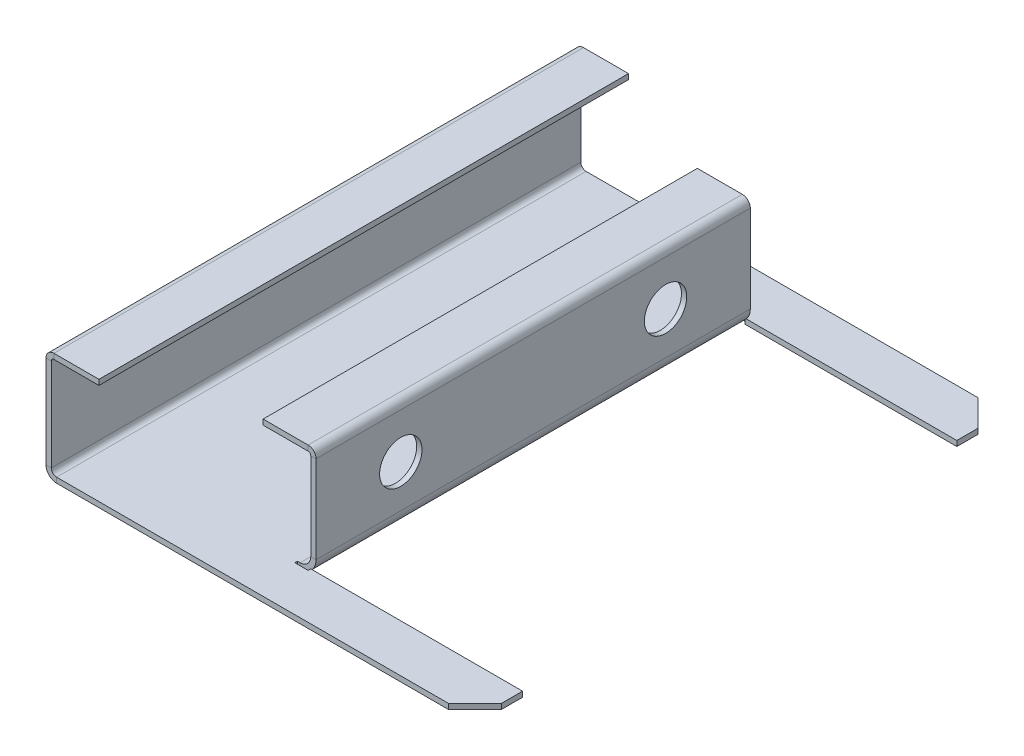
from build123d import *

# Parameters (mm, degrees)
BASE_FLANGE1_DEPTH           = 1
BREAK_CORNER1_START          = 60.104076401
BREAK_CORNER1_OUTLINE_W      = 72.104076401
BREAK_CORNER1_OUTLINE_H      = 3
BREAK_CORNER1_DEPTH          = 3.535533906
BREAK_CORNER1_START_2        = -12
BREAK_CORNER1_2_OUTLINE_W    = 4.895923599
BREAK_CORNER1_2_OUTLINE_H    = 3
BREAK_CORNER1_2_DEPTH        = 11.292893219
EDGE_FLANGE1_STRIP_W         = 6
EDGE_FLANGE1_STRIP_H         = 1
EDGE_FLANGE1_STRIP_CUT_DEPTH = 100
EDGE_FLANGE1_DEPTH           = 100
EDGE_FLANGE2_STRIP_W         = 5
EDGE_FLANGE2_STRIP_H         = 1
EDGE_FLANGE2_STRIP_CUT_DEPTH = 100
EDGE_FLANGE2_DEPTH           = 100
EDGE_FLANGE3_START           = -2.5
EDGE_FLANGE3_OUTLINE_W       = 0.5
EDGE_FLANGE3_OUTLINE_H       = 1
EDGE_FLANGE3_DEPTH           = 2.5
EDGE_FLANGE3_START_2         = -1.23595
EDGE_FLANGE3_2_OUTLINE_W     = 19
EDGE_FLANGE3_2_OUTLINE_H     = 82
EDGE_FLANGE3_2_DEPTH         = 2.23595
EDGE_FLANGE3_3_OUTLINE_W     = 1
EDGE_FLANGE3_3_OUTLINE_H     = 82
EDGE_FLANGE3_3_DEPTH         = 0.70822
EDGE_FLANGE3_START_3         = -41
EDGE_FLANGE3_4_DEPTH         = 82
EDGE_FLANGE3_5_DEPTH         = 82
EDGE_FLANGE4_STRIP_W         = 5
EDGE_FLANGE4_STRIP_H         = 1
EDGE_FLANGE4_STRIP_CUT_DEPTH = 82
EDGE_FLANGE4_DEPTH           = 82
SKETCH18_R                   = 4
CUT_EXTRUDE1_DEPTH           = 10


with BuildPart() as part:
    # Base-Flange1: sheet metal written as solids
    # Sketch1 → Base-Flange1 (new body)
    with BuildSketch(Plane(origin=(0, 0, 0), x_dir=(1, 0, 0), z_dir=(0, 1, 0))):
        Polygon((39.172092849, 50), (40, 50), (40, 41), (0, 41), (0, -41), (40, -41), (40, -50), (-40, -50), (-40, 50), align=None)
    extrude(amount=-BASE_FLANGE1_DEPTH)

    # Break-Corner1: read off the stored shape, not the designer's step
    # Break-Corner1 outline → Break-Corner1 (cut)
    with BuildSketch(Plane(origin=(0, 0, 0), x_dir=(0.707106781186548, 0, -0.707106781186547), z_dir=(0.707106781186547, 0, 0.707106781186548)).offset(BREAK_CORNER1_START)):
        with Locations((24.052038201, -0.5)):
            Rectangle(BREAK_CORNER1_OUTLINE_W, BREAK_CORNER1_OUTLINE_H)
    extrude(amount=BREAK_CORNER1_DEPTH, mode=Mode.SUBTRACT)

    # Break-Corner1 2 outline → Break-Corner1 2 (cut)
    with BuildSketch(Plane(origin=(0, 0, 0), x_dir=(0.707106781186548, 0, -0.707106781186547), z_dir=(0.707106781186547, 0, 0.707106781186548)).offset(BREAK_CORNER1_START_2)):
        with Locations((62.552038201, -0.5)):
            Rectangle(BREAK_CORNER1_2_OUTLINE_W, BREAK_CORNER1_2_OUTLINE_H)
    extrude(amount=BREAK_CORNER1_2_DEPTH, mode=Mode.SUBTRACT)

    # Edge-Flange1: sheet metal written as solids
    # Edge-Flange1 strip (on a plane across the edge) → Edge-Flange1 strip cut (cut)
    with BuildSketch(Plane(origin=(-40, 0, -50), x_dir=(1, 0, 0), z_dir=(0, 0, 1))):
        with Locations((-2, -0.5)):
            Rectangle(EDGE_FLANGE1_STRIP_W, EDGE_FLANGE1_STRIP_H)
    extrude(amount=EDGE_FLANGE1_STRIP_CUT_DEPTH, mode=Mode.SUBTRACT)

    # Edge-Flange1 section (on a plane across the edge) → Edge-Flange1 (add)
    with BuildSketch(Plane(origin=(-40, 0, -50), x_dir=(1, 0, 0), z_dir=(0, 0, 1))):
        with BuildLine():
            Line((-1, 1), (-1, 19))
            Line((-1, 19), (0, 19))
            Line((0, 19), (0, 1))
            ThreePointArc((0, 1), (0.292893219, 0.292893219), (1, 0))
            Line((1, 0), (1, -1))
            ThreePointArc((1, -1), (-0.414213562, -0.414213562), (-1, 1))
        make_face()
    extrude(amount=EDGE_FLANGE1_DEPTH)

    # Edge-Flange2: sheet metal written as solids
    # Edge-Flange2 strip (on a plane across the edge) → Edge-Flange2 strip cut (cut)
    with BuildSketch(Plane(origin=(-40, 19, -50), x_dir=(0, -1, 0), z_dir=(0, 0, 1))):
        with Locations((-2, -0.5)):
            Rectangle(EDGE_FLANGE2_STRIP_W, EDGE_FLANGE2_STRIP_H)
    extrude(amount=EDGE_FLANGE2_STRIP_CUT_DEPTH, mode=Mode.SUBTRACT)

    # Edge-Flange2 section (on a plane across the edge) → Edge-Flange2 (add)
    with BuildSketch(Plane(origin=(-40, 19, -50), x_dir=(0, -1, 0), z_dir=(0, 0, 1))):
        with BuildLine():
            Line((-1, 0.5), (-1, 9))
            Line((-1, 9), (0, 9))
            Line((0, 9), (0, 0.5))
            ThreePointArc((0, 0.5), (0.146446609, 0.146446609), (0.5, 0))
            Line((0.5, 0), (0.5, -1))
            ThreePointArc((0.5, -1), (-0.560660172, -0.560660172), (-1, 0.5))
        make_face()
    extrude(amount=EDGE_FLANGE2_DEPTH)

    # Edge-Flange3: read off the stored shape, not the designer's step
    # Edge-Flange3 outline → Edge-Flange3 (cut)
    with BuildSketch(Plane(origin=(0, 0, 0), x_dir=(0, 0, -1), z_dir=(1, 0, 0)).offset(EDGE_FLANGE3_START)):
        with Locations((41.25, -0.5)):
            Rectangle(EDGE_FLANGE3_OUTLINE_W, EDGE_FLANGE3_OUTLINE_H)
        with Locations((-41.25, -0.5)):
            Rectangle(EDGE_FLANGE3_OUTLINE_W, EDGE_FLANGE3_OUTLINE_H)
    extrude(amount=EDGE_FLANGE3_DEPTH, mode=Mode.SUBTRACT)

    # Edge-Flange3 2 outline → Edge-Flange3 2 (add)
    with BuildSketch(Plane.YZ.offset(EDGE_FLANGE3_START_2)):
        with Locations((9.5, 0)):
            Rectangle(EDGE_FLANGE3_2_OUTLINE_W, EDGE_FLANGE3_2_OUTLINE_H)
    extrude(amount=EDGE_FLANGE3_2_DEPTH)

    # Edge-Flange3 3 outline → Edge-Flange3 3 (add)
    with BuildSketch(Plane.YZ):
        with Locations((-0.5, 0)):
            Rectangle(EDGE_FLANGE3_3_OUTLINE_W, EDGE_FLANGE3_3_OUTLINE_H)
    extrude(amount=EDGE_FLANGE3_3_DEPTH)

    # Edge-Flange3 4 outline → Edge-Flange3 4 (add)
    with BuildSketch(Plane.XY.offset(EDGE_FLANGE3_START_3)):
        with BuildLine():
            Line((-1.23595, -0.901073525), (-1.23595, 0.151696022))
            ThreePointArc((-1.23595, 0.151696022), (-1.610518266, 0.038290547), (-2, 0))
            Line((-2, 0), (-3, -1e-09))
            Line((-3, -1e-09), (-3, -0.999999999))
            Line((-3, -0.999999999), (-2, -1))
            ThreePointArc((-2, -1), (-1.614786147, -0.97516559), (-1.23595, -0.901073525))
        make_face()
    extrude(amount=EDGE_FLANGE3_4_DEPTH)

    # Edge-Flange3 5 outline → Edge-Flange3 5 (cut)
    with BuildSketch(Plane.XY.offset(EDGE_FLANGE3_START_3)):
        with BuildLine():
            Line((0, 2), (0, 19))
            Line((0, 19), (-1.23595, 19))
            Line((-1.23595, 19), (-1.23595, 0.151696022))
            ThreePointArc((-1.23595, 0.151696022), (-0.337456768, 0.888267119), (0, 2))
        make_face()
        with BuildLine():
            Line((1, 0), (1, 2))
            ThreePointArc((1, 2), (0.121320344, -0.121320344), (-2, -1))
            Line((-2, -1), (0.70822, -1))
            Line((0.70822, -1), (0.70822, 0))
            Line((0.70822, 0), (1, 0))
        make_face()
    extrude(amount=EDGE_FLANGE3_5_DEPTH, mode=Mode.SUBTRACT)

    # Edge-Flange4: sheet metal written as solids
    # Edge-Flange4 strip (on a plane across the edge) → Edge-Flange4 strip cut (cut)
    with BuildSketch(Plane(origin=(0, 19, 41), x_dir=(0, -1, 0), z_dir=(0, 0, -1))):
        with Locations((-2, -0.5)):
            Rectangle(EDGE_FLANGE4_STRIP_W, EDGE_FLANGE4_STRIP_H)
    extrude(amount=EDGE_FLANGE4_STRIP_CUT_DEPTH, mode=Mode.SUBTRACT)

    # Edge-Flange4 section (on a plane across the edge) → Edge-Flange4 (add)
    with BuildSketch(Plane(origin=(0, 19, 41), x_dir=(0, -1, 0), z_dir=(0, 0, -1))):
        with BuildLine():
            Line((-1, 0.5), (-1, 9))
            Line((-1, 9), (0, 9))
            Line((0, 9), (0, 0.5))
            ThreePointArc((0, 0.5), (0.146446609, 0.146446609), (0.5, 0))
            Line((0.5, 0), (0.5, -1))
            ThreePointArc((0.5, -1), (-0.560660172, -0.560660172), (-1, 0.5))
        make_face()
    extrude(amount=EDGE_FLANGE4_DEPTH)

    # Sketch18 → Cut-Extrude1 (cut)
    with BuildSketch(Plane(origin=(1, 0, 0), x_dir=(0, 0, -1), z_dir=(1, 0, 0))):
        with Locations(Location((-25, 10, 0), (0, 0, 90))):
            Circle(SKETCH18_R)
        with Locations(Location((25, 10, 0), (0, 0, 90))):
            Circle(SKETCH18_R)
    extrude(amount=-CUT_EXTRUDE1_DEPTH, mode=Mode.SUBTRACT)


solid = part.part
